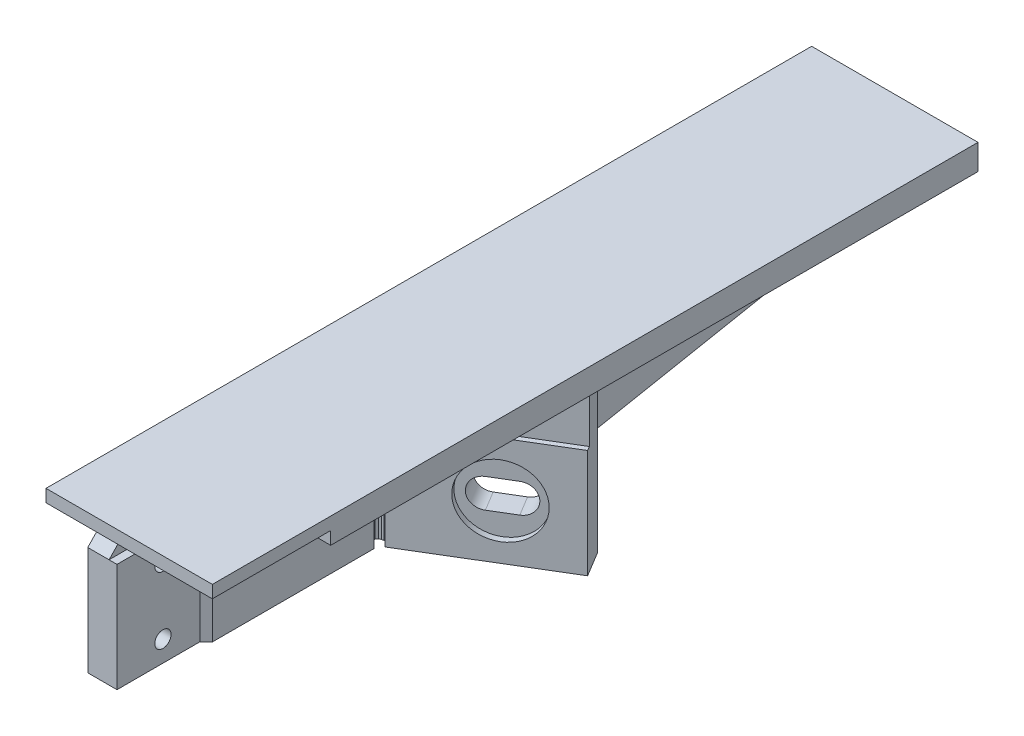
from build123d import *

# Parameters (mm, degrees)
LEG_AND_PAD_DEPTH                     = 13
SCREW_HEAD_RELIEF_SKETCH_W            = 14
SCREW_HEAD_RELIEF_SKETCH_H            = 6
SCREW_HEAD_RELIEF_DEPTH               = 2.35
M6_SLOT_MIDDLE_DEPTH                  = 3.5
SCREW_HOLES_SKETCH_R                  = 1.95
SCREW_HOLES_DEPTH                     = 4.5
FOOT_LEG_DEPTH                        = 6.1
SOLE_UNDER_THE_HOUSING_SKETCH_W       = 39.841788068
SOLE_UNDER_THE_HOUSING_SKETCH_H       = 155.03
SOLE_UNDER_THE_HOUSING_DEPTH          = 3.035
SOLE_UNDER_THE_BLOCK_SKETCH_W         = 39.841788068
SOLE_UNDER_THE_BLOCK_SKETCH_H         = 28.84
SOLE_UNDER_THE_BLOCK_DEPTH            = 1.5
SEAT_GUSSET_DEPTH                     = 2.55
TAIL_RIB_DEPTH                        = 3
SCREW_HEAD_RELIEF_TO_THE_END_SKETCH_W = 14
SCREW_HEAD_RELIEF_TO_THE_END_SKETCH_H = 16
SCREW_HEAD_RELIEF_TO_THE_END_DEPTH    = 2.35


with BuildPart() as part:
    # leg and pad sketch → leg and pad (new, symmetric)
    with BuildSketch(Plane(origin=(0, -20.7, 0), x_dir=(1, 0, 0), z_dir=(0, 1, 0))):
        Polygon((0.551289683, 30.332713936), (0.367250577, 30.819395741), (0.028023026, 31.213926146), (-0.425575667, 31.468833575), (-0.938966578, 31.553446481), (-1.450376329, 31.457583879), (-1.898269923, 31.192780366), (-2.228754897, 30.790898227), (-2.402065893, 30.30029363), (-2.397349395, 29.779998208), (-2.215172912, 29.292616119), (-1.877456693, 28.896791249), (-1.424836191, 28.640150931), (-0.91177263, 28.55357522), (-0.4, 28.647481273), (-0.4, -9.98), (-1.92, -11.5), (-1.92, -31.37), (-8.92, -31.37), (-8.92, 32.792642706), (27.204821487, 54.594667874), (30.821788068, 48.601542416), align=None)
    extrude(amount=LEG_AND_PAD_DEPTH, both=True)

    # screw head relief sketch → screw head relief (cut, symmetric)
    with BuildSketch(Plane(origin=(-1.35, 0, 0), x_dir=(0, 0, -1), z_dir=(1, 0, 0))):
        with Locations((16.4, -9.7)):
            Rectangle(SCREW_HEAD_RELIEF_SKETCH_W, SCREW_HEAD_RELIEF_SKETCH_H)
    extrude(amount=SCREW_HEAD_RELIEF_DEPTH, both=True, mode=Mode.SUBTRACT)

    # insert flange relief sketch → insert flange relief (revolve, cut)
    with BuildSketch(Plane(origin=(0, -20.7, 0), x_dir=(1, 0, 0), z_dir=(0, 1, 0))):
        Polygon((18.324853729, 39.891397061), (17.03307995, 42.03179901), (9.755713323, 37.639768162), (11.047487102, 35.499366213), align=None)
    revolve(axis=Axis((18.324853729, -20.7, -39.891397061), (-0.5167095115681243, 0, -0.8561607796757748)), mode=Mode.SUBTRACT)

    # M6 slot end 1 sketch → M6 slot end 1 (revolve, cut)
    with BuildSketch(Plane(origin=(0, -20.7, 0), x_dir=(1, 0, 0), z_dir=(0, 1, 0))):
        Polygon((20.893336068, 41.441525596), (16.242950464, 49.146972613), (13.246387735, 47.338489322), (17.896773339, 39.633042305), align=None)
    revolve(axis=Axis((20.893336068, -20.7, -41.441525596), (-0.5167095115681233, 0, -0.8561607796757753)), mode=Mode.SUBTRACT)

    # M6 slot end 2 sketch → M6 slot end 2 (revolve, cut)
    with BuildSketch(Plane(origin=(0, -20.7, 0), x_dir=(1, 0, 0), z_dir=(0, 1, 0))):
        Polygon((15.75637139, 38.341268526), (11.105985786, 46.046715543), (8.109423057, 44.238232253), (12.759808661, 36.532785236), align=None)
    revolve(axis=Axis((15.75637139, -20.7, -38.341268526), (-0.5167095115681234, 0, -0.8561607796757752)), mode=Mode.SUBTRACT)

    # M6 slot middle sketch → M6 slot middle (cut, symmetric)
    with BuildSketch(Plane(origin=(0, -20.7, 0), x_dir=(1, 0, 0), z_dir=(0, 1, 0))):
        Polygon((15.75637139, 38.341268526), (20.893336068, 41.441525596), (16.242950464, 49.146972613), (11.105985786, 46.046715543), align=None)
    extrude(amount=M6_SLOT_MIDDLE_DEPTH, both=True, mode=Mode.SUBTRACT)

    # screw holes sketch → screw holes (cut, symmetric)
    with BuildSketch(Plane(origin=(-5.42, 0, 0), x_dir=(0, 0, -1), z_dir=(1, 0, 0))):
        with Locations((-20.375, -28.7)):
            Circle(SCREW_HOLES_SKETCH_R)
        with Locations((-20.375, -12.7)):
            Circle(SCREW_HOLES_SKETCH_R)
    extrude(amount=SCREW_HOLES_DEPTH, both=True, mode=Mode.SUBTRACT)

    # foot leg sketch → foot leg (add, symmetric)
    with BuildSketch(Plane(origin=(0, -2.1, 0), x_dir=(1, 0, 0), z_dir=(0, 1, 0))):
        Polygon((-2.3, 30.013511625), (-2.3, -9.98), (-8.92, -9.98), (-8.92, 32.792642706), (27.204821487, 54.594667874), (30.201736654, 49.628935352), align=None)
    extrude(amount=FOOT_LEG_DEPTH, both=True)

    # sole under the housing sketch → sole under the housing (add, symmetric)
    with BuildSketch(Plane(origin=(0, 6.535, 0), x_dir=(1, 0, 0), z_dir=(0, 1, 0))):
        with Locations((11.000894034, 64.485)):
            Rectangle(SOLE_UNDER_THE_HOUSING_SKETCH_W, SOLE_UNDER_THE_HOUSING_SKETCH_H)
    extrude(amount=SOLE_UNDER_THE_HOUSING_DEPTH, both=True)

    # sole under the block sketch → sole under the block (add, symmetric)
    with BuildSketch(Plane(origin=(0, 8.07, 0), x_dir=(1, 0, 0), z_dir=(0, 1, 0))):
        with Locations((11.000894034, -26.95)):
            Rectangle(SOLE_UNDER_THE_BLOCK_SKETCH_W, SOLE_UNDER_THE_BLOCK_SKETCH_H)
    extrude(amount=SOLE_UNDER_THE_BLOCK_DEPTH, both=True)

    # seat gusset sketch → seat gusset (add, symmetric)
    with BuildSketch(Plane(origin=(-6.37, 0, 0), x_dir=(0, 0, -1), z_dir=(1, 0, 0))):
        Polygon((-9.48, -8.2), (-31.37, -8.2), (-31.37, -7.7), (-17.1, 7.07), (-9.48, 7.07), align=None)
    extrude(amount=SEAT_GUSSET_DEPTH, both=True)

    # tail rib sketch → tail rib (add, symmetric)
    with BuildSketch(Plane(origin=(19.921788068, 0, 0), x_dir=(0, 0, -1), z_dir=(1, 0, 0))):
        Polygon((53.1, 4), (53.1, -12.5), (57.1, -12.5), (140, 3.5), (140, 4), align=None)
    extrude(amount=TAIL_RIB_DEPTH, both=True)

    # screw head relief to the end sketch → screw head relief to the end (cut, symmetric)
    with BuildSketch(Plane(origin=(-1.35, 0, 0), x_dir=(0, 0, -1), z_dir=(1, 0, 0))):
        with Locations((16.4, -4.7)):
            Rectangle(SCREW_HEAD_RELIEF_TO_THE_END_SKETCH_W, SCREW_HEAD_RELIEF_TO_THE_END_SKETCH_H)
    extrude(amount=SCREW_HEAD_RELIEF_TO_THE_END_DEPTH, both=True, mode=Mode.SUBTRACT)


solid = part.part
